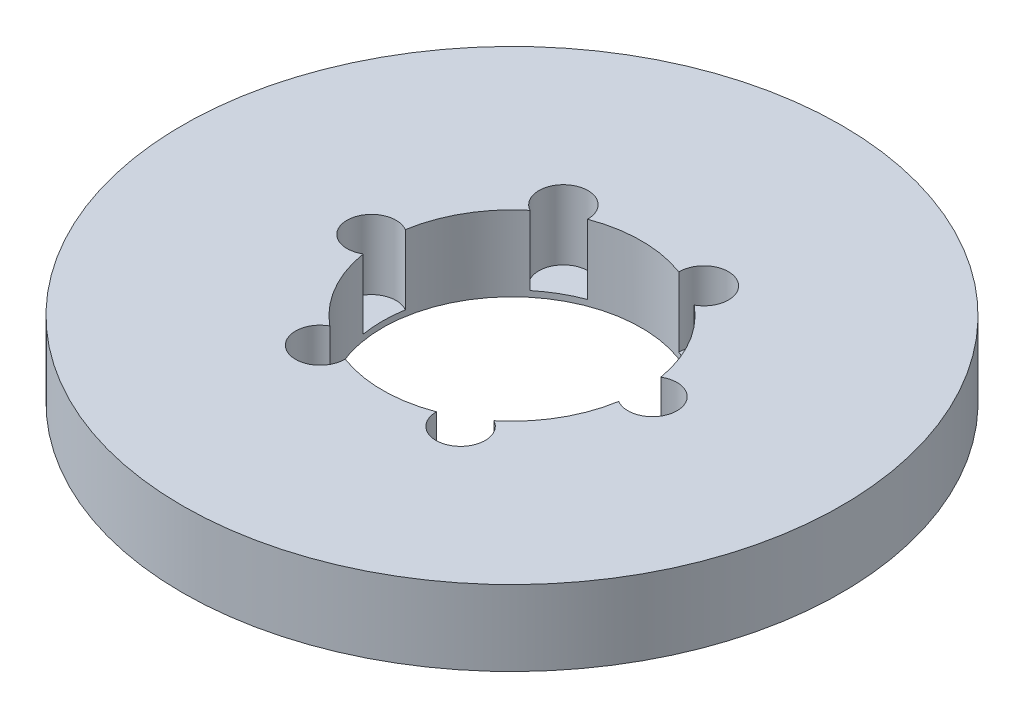
from build123d import *

# Parameters (mm, degrees)
SKETCH1_R           = 70
BOSS_EXTRUDE1_DEPTH = 16
SKETCH2_R           = 27.5
CUT_EXTRUDE1_DEPTH  = 101.279609094
SKETCH3_R           = 5.21964116
CUT_EXTRUDE2_DEPTH  = 14.761101501
CIRPATTERN1_COUNT   = 6


with BuildPart() as part:
    # Sketch1 → Boss-Extrude1 (new body)
    with BuildSketch(Plane(origin=(0, 0, 0), x_dir=(1, 0, 0), z_dir=(0, 1, 0))):
        Circle(SKETCH1_R)
    extrude(amount=BOSS_EXTRUDE1_DEPTH)

    # Sketch2 → Cut-Extrude1 (cut, through all)
    with BuildSketch(Plane(origin=(0, 0, 0), x_dir=(1, 0, 0), z_dir=(0, 1, 0))):
        Circle(SKETCH2_R)
    extrude(amount=CUT_EXTRUDE1_DEPTH, mode=Mode.SUBTRACT)

    # Sketch3 → Cut-Extrude2 (cut)
    with BuildSketch(Plane(origin=(0, 16, 0), x_dir=(1, 0, 0), z_dir=(0, 1, 0))):
        with Locations((-29.839003919, 0)):
            Circle(SKETCH3_R)
    cut_extrude2 = extrude(amount=-CUT_EXTRUDE2_DEPTH, mode=Mode.SUBTRACT)

    # CirPattern1: Cut-Extrude2 ×6 about axis
    cirpattern1_axis = Axis((0, 0, 0), (0, 1, 0))
    for i in range(1, CIRPATTERN1_COUNT):
        add(cut_extrude2.rotate(cirpattern1_axis, i * 360 / CIRPATTERN1_COUNT), mode=Mode.SUBTRACT)


solid = part.part
